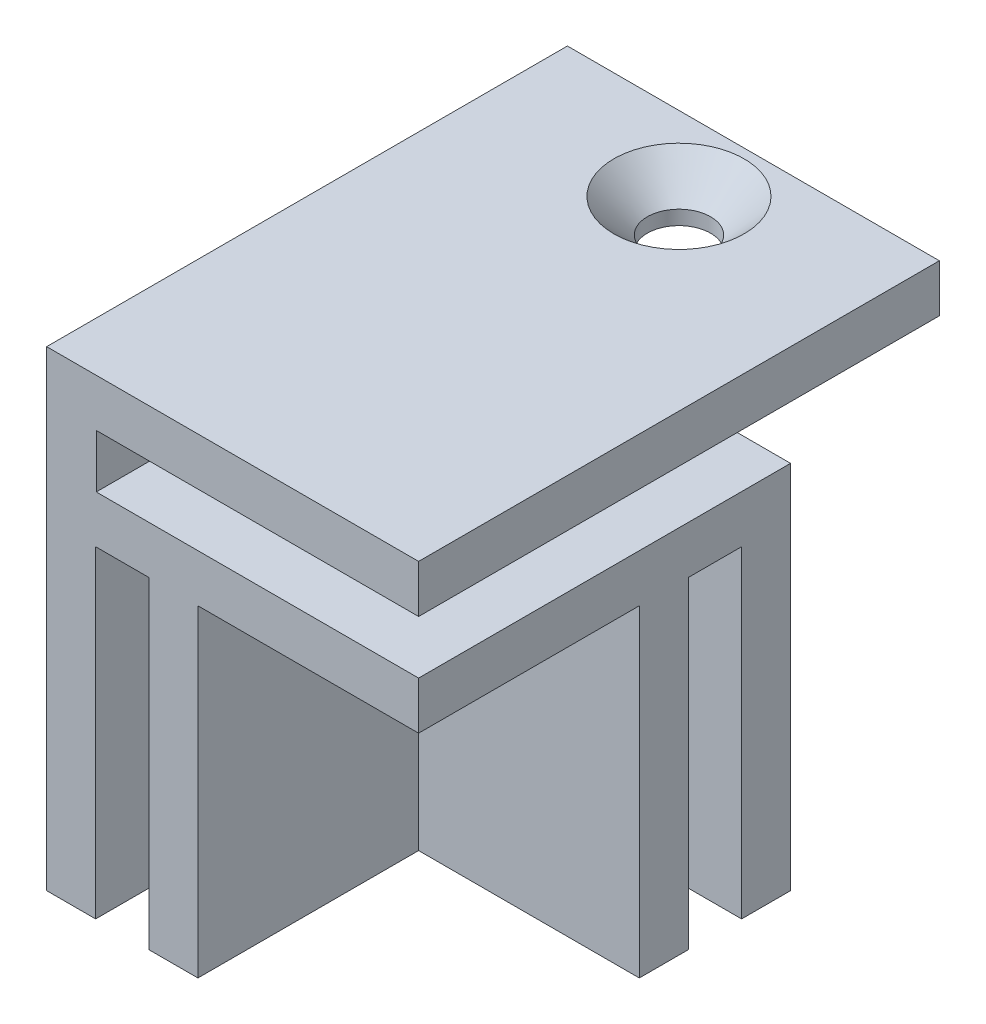
from build123d import *

# Parameters (mm, degrees)
ESQUISSE1_W                                       = 30
ESQUISSE1_H                                       = 30
BOSS_EXTRU_1_DEPTH                                = 38
ESQUISSE2_W                                       = 17.8
ESQUISSE2_H                                       = 4.3
ESQUISSE2_W_2                                     = 4.3
ESQUISSE2_H_2                                     = 17.8
ENL_V_MAT_EXTRU_1_DEPTH                           = 26
ESQUISSE3_W                                       = 26
ESQUISSE3_H                                       = 4.3
ENL_V_MAT_EXTRU_3_DEPTH                           = 61.264898469
ESQUISSE4_W                                       = 30
ESQUISSE4_H                                       = 3.85
BOSS_EXTRU_2_DEPTH                                = 12
FRAISAGE_POUR_VIS_T_TE_FRAIS_E_BOMB_E_D           = 5.09999996
FRAISAGE_POUR_VIS_T_TE_FRAIS_E_BOMB_E_CSINK_D     = 10.500000082
FRAISAGE_POUR_VIS_T_TE_FRAIS_E_BOMB_E_CSINK_ANGLE = 90


with BuildPart() as part:
    # Esquisse1 → Boss.-Extru.1 (new body)
    with BuildSketch(Plane(origin=(0, 0, 0), x_dir=(1, 0, 0), z_dir=(0, 1, 0))):
        with Locations((-20.886738322, -1.468531469)):
            Rectangle(ESQUISSE1_W, ESQUISSE1_H)
    extrude(amount=BOSS_EXTRU_1_DEPTH)

    # Esquisse2 → Enlèv. mat.-Extru.1 (cut)
    with BuildSketch(Plane.XZ):
        with Locations((-14.786738322, -7.431468531)):
            Rectangle(ESQUISSE2_W, ESQUISSE2_H)
        with Locations((-29.786738322, 7.568531469)):
            Rectangle(ESQUISSE2_W_2, ESQUISSE2_H_2)
        with Locations((-14.786738322, 7.568531469)):
            Rectangle(ESQUISSE2_W, ESQUISSE2_H_2)
    extrude(amount=-ENL_V_MAT_EXTRU_1_DEPTH, mode=Mode.SUBTRACT)

    # Esquisse3 → Enlèv. mat.-Extru.3 (cut, through all)
    with BuildSketch(Plane.XY.offset(16.468531469)):
        with Locations((-18.886738322, 32)):
            Rectangle(ESQUISSE3_W, ESQUISSE3_H)
    extrude(amount=-ENL_V_MAT_EXTRU_3_DEPTH, mode=Mode.SUBTRACT)

    # Esquisse4 → Boss.-Extru.2 (add)
    with BuildSketch(Plane(origin=(0, 0, -13.531468531), x_dir=(-1, 0, 0), z_dir=(0, 0, -1))):
        with Locations((20.886738322, 36.075)):
            Rectangle(ESQUISSE4_W, ESQUISSE4_H)
    extrude(amount=BOSS_EXTRU_2_DEPTH)

    # Fraisage pour vis à tête fraisée bombée #51 (through all)
    with Locations(Plane(origin=(-20.886738322, 38, -19.531468531), x_dir=(0, 0, 1), z_dir=(0, 1, 0))):
        with Locations((0, 0)):
            CounterSinkHole(FRAISAGE_POUR_VIS_T_TE_FRAIS_E_BOMB_E_D / 2, FRAISAGE_POUR_VIS_T_TE_FRAIS_E_BOMB_E_CSINK_D / 2, counter_sink_angle=FRAISAGE_POUR_VIS_T_TE_FRAIS_E_BOMB_E_CSINK_ANGLE)


solid = part.part
